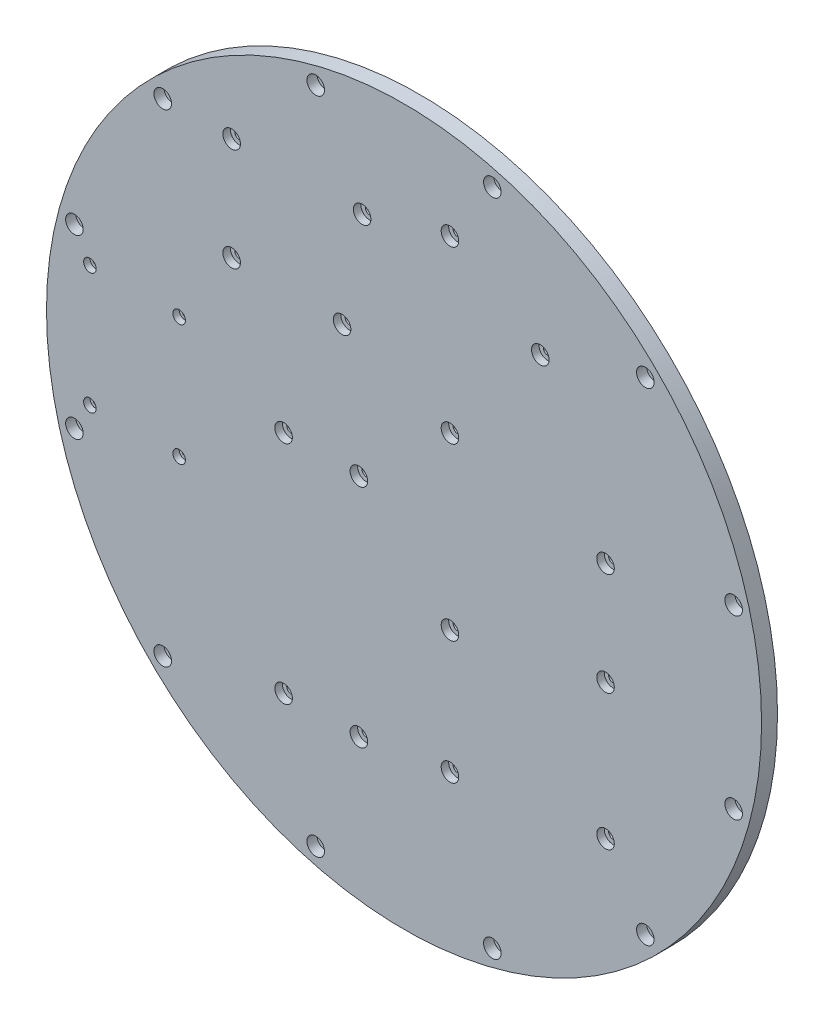
from build123d import *

# Parameters (mm, degrees)
ESQUISSE1_R              = 142.5
ESQUISSE1_R_2            = 1.75
BOSS_EXTRU_1_DEPTH       = 6.35
ESQUISSE2_R              = 3.5
ENL_V_MAT_EXTRU_1_DEPTH  = 4
ENL_V_MAT_EXTRU_2_REACH  = 203.625
ESQUISSE3_R              = 1.25
ESQUISSE4_R              = 2.5
ENL_V_MAT_EXTRU_3_DEPTH  = 2.5
ENL_V_MAT_EXTRU_4_REACH  = 203.625
ESQUISSE5_R              = 1.75
ESQUISSE6_R              = 3.5
ENL_V_MAT_EXTRU_5_DEPTH  = 3
ENL_V_MAT_EXTRU_6_REACH  = 203.625
ESQUISSE7_R              = 1.75
ESQUISSE8_R              = 3.5
ENL_V_MAT_EXTRU_7_DEPTH  = 3
ENL_V_MAT_EXTRU_8_REACH  = 203.625
ESQUISSE9_R              = 1.75
ESQUISSE10_R             = 3.5
ENL_V_MAT_EXTRU_9_DEPTH  = 3
ENL_V_MAT_EXTRU_10_REACH = 203.625
ESQUISSE11_R             = 1.75
ESQUISSE12_R             = 3.5
ENL_V_MAT_EXTRU_11_DEPTH = 3


with BuildPart() as part:
    # Esquisse1 → Boss.-Extru.1 (new body)
    with BuildSketch(Plane.XY):
        Circle(ESQUISSE1_R)
        with Locations((-35.199390134, 131.365912375)):
            Circle(ESQUISSE1_R_2, mode=Mode.SUBTRACT)
        with Locations((35.199390134, 131.365912375)):
            Circle(ESQUISSE1_R_2, mode=Mode.SUBTRACT)
        with Locations((96.166522241, 96.166522241)):
            Circle(ESQUISSE1_R_2, mode=Mode.SUBTRACT)
        with Locations((131.365912375, 35.199390134)):
            Circle(ESQUISSE1_R_2, mode=Mode.SUBTRACT)
        with Locations((131.365912375, -35.199390134)):
            Circle(ESQUISSE1_R_2, mode=Mode.SUBTRACT)
        with Locations((96.166522241, -96.166522241)):
            Circle(ESQUISSE1_R_2, mode=Mode.SUBTRACT)
        with Locations((35.199390134, -131.365912375)):
            Circle(ESQUISSE1_R_2, mode=Mode.SUBTRACT)
        with Locations((-35.199390134, -131.365912375)):
            Circle(ESQUISSE1_R_2, mode=Mode.SUBTRACT)
        with Locations((-96.166522241, -96.166522241)):
            Circle(ESQUISSE1_R_2, mode=Mode.SUBTRACT)
        with Locations((-131.365912375, -35.199390134)):
            Circle(ESQUISSE1_R_2, mode=Mode.SUBTRACT)
        with Locations((-131.365912375, 35.199390134)):
            Circle(ESQUISSE1_R_2, mode=Mode.SUBTRACT)
        with Locations((-96.166522241, 96.166522241)):
            Circle(ESQUISSE1_R_2, mode=Mode.SUBTRACT)
    extrude(amount=BOSS_EXTRU_1_DEPTH)

    # Esquisse2 → Enlèv. mat.-Extru.1 (cut)
    with BuildSketch(Plane.XY.offset(6.35)):
        with Locations((35.199390134, 131.365912375)):
            Circle(ESQUISSE2_R)
        with Locations((96.166522241, 96.166522241)):
            Circle(ESQUISSE2_R)
        with Locations((131.365912375, 35.199390134)):
            Circle(ESQUISSE2_R)
        with Locations((131.365912375, -35.199390134)):
            Circle(ESQUISSE2_R)
        with Locations((96.166522241, -96.166522241)):
            Circle(ESQUISSE2_R)
        with Locations((35.199390134, -131.365912375)):
            Circle(ESQUISSE2_R)
        with Locations((-35.199390134, -131.365912375)):
            Circle(ESQUISSE2_R)
        with Locations((-96.166522241, -96.166522241)):
            Circle(ESQUISSE2_R)
        with Locations((-131.365912375, -35.199390134)):
            Circle(ESQUISSE2_R)
        with Locations((-131.365912375, 35.199390134)):
            Circle(ESQUISSE2_R)
        with Locations((-96.166522241, 96.166522241)):
            Circle(ESQUISSE2_R)
        with Locations((-35.199390134, 131.365912375)):
            Circle(ESQUISSE2_R)
    extrude(amount=-ENL_V_MAT_EXTRU_1_DEPTH, mode=Mode.SUBTRACT)

    # Esquisse3 → Enlèv. mat.-Extru.2 (cut, up to next)
    with BuildSketch(Plane.XY.offset(6.35), mode=Mode.PRIVATE) as enl_v_mat_extru_2_sk1:
        with Locations((-125.19581902, -24.13)):
            Circle(ESQUISSE3_R)
    enl_v_mat_extru_2_tool1 = extrude(enl_v_mat_extru_2_sk1.sketch, amount=-ENL_V_MAT_EXTRU_2_REACH, mode=Mode.PRIVATE) & part.part
    # Esquisse3 → Enlèv. mat.-Extru.2 (cut, up to next)
    with BuildSketch(Plane.XY.offset(6.35), mode=Mode.PRIVATE) as enl_v_mat_extru_2_sk2:
        with Locations((-125.19581902, 24.13)):
            Circle(ESQUISSE3_R)
    enl_v_mat_extru_2_tool2 = extrude(enl_v_mat_extru_2_sk2.sketch, amount=-ENL_V_MAT_EXTRU_2_REACH, mode=Mode.PRIVATE) & part.part
    # Esquisse3 → Enlèv. mat.-Extru.2 (cut, up to next)
    with BuildSketch(Plane.XY.offset(6.35), mode=Mode.PRIVATE) as enl_v_mat_extru_2_sk3:
        with Locations((-89.63581902, 24.13)):
            Circle(ESQUISSE3_R)
    enl_v_mat_extru_2_tool3 = extrude(enl_v_mat_extru_2_sk3.sketch, amount=-ENL_V_MAT_EXTRU_2_REACH, mode=Mode.PRIVATE) & part.part
    # Esquisse3 → Enlèv. mat.-Extru.2 (cut, up to next)
    with BuildSketch(Plane.XY.offset(6.35), mode=Mode.PRIVATE) as enl_v_mat_extru_2_sk4:
        with Locations((-89.63581902, -24.13)):
            Circle(ESQUISSE3_R)
    enl_v_mat_extru_2_tool4 = extrude(enl_v_mat_extru_2_sk4.sketch, amount=-ENL_V_MAT_EXTRU_2_REACH, mode=Mode.PRIVATE) & part.part
    add(enl_v_mat_extru_2_tool1.solids().sort_by_distance((-125.195819, -24.13, 6.35))[0], mode=Mode.SUBTRACT)
    add(enl_v_mat_extru_2_tool2.solids().sort_by_distance((-125.195819, 24.13, 6.35))[0], mode=Mode.SUBTRACT)
    add(enl_v_mat_extru_2_tool3.solids().sort_by_distance((-89.635819, 24.13, 6.35))[0], mode=Mode.SUBTRACT)
    add(enl_v_mat_extru_2_tool4.solids().sort_by_distance((-89.635819, -24.13, 6.35))[0], mode=Mode.SUBTRACT)

    # Esquisse4 → Enlèv. mat.-Extru.3 (cut)
    with BuildSketch(Plane.XY.offset(6.35)):
        with Locations((-125.19581902, -24.13)):
            Circle(ESQUISSE4_R)
        with Locations((-125.19581902, 24.13)):
            Circle(ESQUISSE4_R)
        with Locations((-89.63581902, 24.13)):
            Circle(ESQUISSE4_R)
        with Locations((-89.63581902, -24.13)):
            Circle(ESQUISSE4_R)
    extrude(amount=-ENL_V_MAT_EXTRU_3_DEPTH, mode=Mode.SUBTRACT)

    # Esquisse5 → Enlèv. mat.-Extru.4 (cut, up to next)
    with BuildSketch(Plane.XY.offset(6.35), mode=Mode.PRIVATE) as enl_v_mat_extru_4_sk1:
        with Locations((-48, -85)):
            Circle(ESQUISSE5_R)
    enl_v_mat_extru_4_tool1 = extrude(enl_v_mat_extru_4_sk1.sketch, amount=-ENL_V_MAT_EXTRU_4_REACH, mode=Mode.PRIVATE) & part.part
    # Esquisse5 → Enlèv. mat.-Extru.4 (cut, up to next)
    with BuildSketch(Plane.XY.offset(6.35), mode=Mode.PRIVATE) as enl_v_mat_extru_4_sk2:
        with Locations((-48, 5)):
            Circle(ESQUISSE5_R)
    enl_v_mat_extru_4_tool2 = extrude(enl_v_mat_extru_4_sk2.sketch, amount=-ENL_V_MAT_EXTRU_4_REACH, mode=Mode.PRIVATE) & part.part
    # Esquisse5 → Enlèv. mat.-Extru.4 (cut, up to next)
    with BuildSketch(Plane.XY.offset(6.35), mode=Mode.PRIVATE) as enl_v_mat_extru_4_sk3:
        with Locations((-18, 5)):
            Circle(ESQUISSE5_R)
    enl_v_mat_extru_4_tool3 = extrude(enl_v_mat_extru_4_sk3.sketch, amount=-ENL_V_MAT_EXTRU_4_REACH, mode=Mode.PRIVATE) & part.part
    # Esquisse5 → Enlèv. mat.-Extru.4 (cut, up to next)
    with BuildSketch(Plane.XY.offset(6.35), mode=Mode.PRIVATE) as enl_v_mat_extru_4_sk4:
        with Locations((-18, -85)):
            Circle(ESQUISSE5_R)
    enl_v_mat_extru_4_tool4 = extrude(enl_v_mat_extru_4_sk4.sketch, amount=-ENL_V_MAT_EXTRU_4_REACH, mode=Mode.PRIVATE) & part.part
    add(enl_v_mat_extru_4_tool1.solids().sort_by_distance((-48, -85, 6.35))[0], mode=Mode.SUBTRACT)
    add(enl_v_mat_extru_4_tool2.solids().sort_by_distance((-48, 5, 6.35))[0], mode=Mode.SUBTRACT)
    add(enl_v_mat_extru_4_tool3.solids().sort_by_distance((-18, 5, 6.35))[0], mode=Mode.SUBTRACT)
    add(enl_v_mat_extru_4_tool4.solids().sort_by_distance((-18, -85, 6.35))[0], mode=Mode.SUBTRACT)

    # Esquisse6 → Enlèv. mat.-Extru.5 (cut)
    with BuildSketch(Plane.XY.offset(6.35)):
        with Locations((-48, -85)):
            Circle(ESQUISSE6_R)
        with Locations((-18, -85)):
            Circle(ESQUISSE6_R)
        with Locations((-48, 5)):
            Circle(ESQUISSE6_R)
        with Locations((-18, 5)):
            Circle(ESQUISSE6_R)
    extrude(amount=-ENL_V_MAT_EXTRU_5_DEPTH, mode=Mode.SUBTRACT)

    # Esquisse7 → Enlèv. mat.-Extru.6 (cut, up to next)
    with BuildSketch(Plane.XY.offset(6.35), mode=Mode.PRIVATE) as enl_v_mat_extru_6_sk1:
        with Locations((-68.7, 55)):
            Circle(ESQUISSE7_R)
    enl_v_mat_extru_6_tool1 = extrude(enl_v_mat_extru_6_sk1.sketch, amount=-ENL_V_MAT_EXTRU_6_REACH, mode=Mode.PRIVATE) & part.part
    # Esquisse7 → Enlèv. mat.-Extru.6 (cut, up to next)
    with BuildSketch(Plane.XY.offset(6.35), mode=Mode.PRIVATE) as enl_v_mat_extru_6_sk2:
        with Locations((-68.7, 96)):
            Circle(ESQUISSE7_R)
    enl_v_mat_extru_6_tool2 = extrude(enl_v_mat_extru_6_sk2.sketch, amount=-ENL_V_MAT_EXTRU_6_REACH, mode=Mode.PRIVATE) & part.part
    # Esquisse7 → Enlèv. mat.-Extru.6 (cut, up to next)
    with BuildSketch(Plane.XY.offset(6.35), mode=Mode.PRIVATE) as enl_v_mat_extru_6_sk3:
        with Locations((-24.7, 54)):
            Circle(ESQUISSE7_R)
    enl_v_mat_extru_6_tool3 = extrude(enl_v_mat_extru_6_sk3.sketch, amount=-ENL_V_MAT_EXTRU_6_REACH, mode=Mode.PRIVATE) & part.part
    # Esquisse7 → Enlèv. mat.-Extru.6 (cut, up to next)
    with BuildSketch(Plane.XY.offset(6.35), mode=Mode.PRIVATE) as enl_v_mat_extru_6_sk4:
        with Locations((-16.7, 96)):
            Circle(ESQUISSE7_R)
    enl_v_mat_extru_6_tool4 = extrude(enl_v_mat_extru_6_sk4.sketch, amount=-ENL_V_MAT_EXTRU_6_REACH, mode=Mode.PRIVATE) & part.part
    add(enl_v_mat_extru_6_tool1.solids().sort_by_distance((-68.7, 55, 6.35))[0], mode=Mode.SUBTRACT)
    add(enl_v_mat_extru_6_tool2.solids().sort_by_distance((-68.7, 96, 6.35))[0], mode=Mode.SUBTRACT)
    add(enl_v_mat_extru_6_tool3.solids().sort_by_distance((-24.7, 54, 6.35))[0], mode=Mode.SUBTRACT)
    add(enl_v_mat_extru_6_tool4.solids().sort_by_distance((-16.7, 96, 6.35))[0], mode=Mode.SUBTRACT)

    # Esquisse8 → Enlèv. mat.-Extru.7 (cut)
    with BuildSketch(Plane.XY.offset(6.35)):
        with Locations((-68.7, 55)):
            Circle(ESQUISSE8_R)
        with Locations((-68.7, 96)):
            Circle(ESQUISSE8_R)
        with Locations((-24.7, 54)):
            Circle(ESQUISSE8_R)
        with Locations((-16.7, 96)):
            Circle(ESQUISSE8_R)
    extrude(amount=-ENL_V_MAT_EXTRU_7_DEPTH, mode=Mode.SUBTRACT)

    # Esquisse9 → Enlèv. mat.-Extru.8 (cut, up to next)
    with BuildSketch(Plane(origin=(0, 0, 6.35), x_dir=(-1, 0, 0), z_dir=(0, 0, -1)), mode=Mode.PRIVATE) as enl_v_mat_extru_8_sk1:
        with Locations((-18.3, 106)):
            Circle(ESQUISSE9_R)
    enl_v_mat_extru_8_tool1 = extrude(enl_v_mat_extru_8_sk1.sketch, amount=ENL_V_MAT_EXTRU_8_REACH, mode=Mode.PRIVATE) & part.part
    # Esquisse9 → Enlèv. mat.-Extru.8 (cut, up to next)
    with BuildSketch(Plane(origin=(0, 0, 6.35), x_dir=(-1, 0, 0), z_dir=(0, 0, -1)), mode=Mode.PRIVATE) as enl_v_mat_extru_8_sk2:
        with Locations((-18.3, 38)):
            Circle(ESQUISSE9_R)
    enl_v_mat_extru_8_tool2 = extrude(enl_v_mat_extru_8_sk2.sketch, amount=ENL_V_MAT_EXTRU_8_REACH, mode=Mode.PRIVATE) & part.part
    # Esquisse9 → Enlèv. mat.-Extru.8 (cut, up to next)
    with BuildSketch(Plane(origin=(0, 0, 6.35), x_dir=(-1, 0, 0), z_dir=(0, 0, -1)), mode=Mode.PRIVATE) as enl_v_mat_extru_8_sk3:
        with Locations((-54.3, 83)):
            Circle(ESQUISSE9_R)
    enl_v_mat_extru_8_tool3 = extrude(enl_v_mat_extru_8_sk3.sketch, amount=ENL_V_MAT_EXTRU_8_REACH, mode=Mode.PRIVATE) & part.part
    # Esquisse9 → Enlèv. mat.-Extru.8 (cut, up to next)
    with BuildSketch(Plane(origin=(0, 0, 6.35), x_dir=(-1, 0, 0), z_dir=(0, 0, -1)), mode=Mode.PRIVATE) as enl_v_mat_extru_8_sk4:
        with Locations((-80.3, 24)):
            Circle(ESQUISSE9_R)
    enl_v_mat_extru_8_tool4 = extrude(enl_v_mat_extru_8_sk4.sketch, amount=ENL_V_MAT_EXTRU_8_REACH, mode=Mode.PRIVATE) & part.part
    add(enl_v_mat_extru_8_tool1.solids().sort_by_distance((18.3, 106, 6.35))[0], mode=Mode.SUBTRACT)
    add(enl_v_mat_extru_8_tool2.solids().sort_by_distance((18.3, 38, 6.35))[0], mode=Mode.SUBTRACT)
    add(enl_v_mat_extru_8_tool3.solids().sort_by_distance((54.3, 83, 6.35))[0], mode=Mode.SUBTRACT)
    add(enl_v_mat_extru_8_tool4.solids().sort_by_distance((80.3, 24, 6.35))[0], mode=Mode.SUBTRACT)

    # Esquisse10 → Enlèv. mat.-Extru.9 (cut)
    with BuildSketch(Plane.XY.offset(6.35)):
        with Locations((18.3, 38)):
            Circle(ESQUISSE10_R)
        with Locations((18.3, 106)):
            Circle(ESQUISSE10_R)
        with Locations((54.3, 83)):
            Circle(ESQUISSE10_R)
        with Locations((80.3, 24)):
            Circle(ESQUISSE10_R)
    extrude(amount=-ENL_V_MAT_EXTRU_9_DEPTH, mode=Mode.SUBTRACT)

    # Esquisse11 → Enlèv. mat.-Extru.10 (cut, up to next)
    with BuildSketch(Plane(origin=(0, 0, 6.35), x_dir=(-1, 0, 0), z_dir=(0, 0, -1)), mode=Mode.PRIVATE) as enl_v_mat_extru_10_sk1:
        with Locations((-18.3, -30)):
            Circle(ESQUISSE11_R)
    enl_v_mat_extru_10_tool1 = extrude(enl_v_mat_extru_10_sk1.sketch, amount=ENL_V_MAT_EXTRU_10_REACH, mode=Mode.PRIVATE) & part.part
    # Esquisse11 → Enlèv. mat.-Extru.10 (cut, up to next)
    with BuildSketch(Plane(origin=(0, 0, 6.35), x_dir=(-1, 0, 0), z_dir=(0, 0, -1)), mode=Mode.PRIVATE) as enl_v_mat_extru_10_sk2:
        with Locations((-18.3, -79)):
            Circle(ESQUISSE11_R)
    enl_v_mat_extru_10_tool2 = extrude(enl_v_mat_extru_10_sk2.sketch, amount=ENL_V_MAT_EXTRU_10_REACH, mode=Mode.PRIVATE) & part.part
    # Esquisse11 → Enlèv. mat.-Extru.10 (cut, up to next)
    with BuildSketch(Plane(origin=(0, 0, 6.35), x_dir=(-1, 0, 0), z_dir=(0, 0, -1)), mode=Mode.PRIVATE) as enl_v_mat_extru_10_sk3:
        with Locations((-80.3, -17)):
            Circle(ESQUISSE11_R)
    enl_v_mat_extru_10_tool3 = extrude(enl_v_mat_extru_10_sk3.sketch, amount=ENL_V_MAT_EXTRU_10_REACH, mode=Mode.PRIVATE) & part.part
    # Esquisse11 → Enlèv. mat.-Extru.10 (cut, up to next)
    with BuildSketch(Plane(origin=(0, 0, 6.35), x_dir=(-1, 0, 0), z_dir=(0, 0, -1)), mode=Mode.PRIVATE) as enl_v_mat_extru_10_sk4:
        with Locations((-80.3, -71)):
            Circle(ESQUISSE11_R)
    enl_v_mat_extru_10_tool4 = extrude(enl_v_mat_extru_10_sk4.sketch, amount=ENL_V_MAT_EXTRU_10_REACH, mode=Mode.PRIVATE) & part.part
    add(enl_v_mat_extru_10_tool1.solids().sort_by_distance((18.3, -30, 6.35))[0], mode=Mode.SUBTRACT)
    add(enl_v_mat_extru_10_tool2.solids().sort_by_distance((18.3, -79, 6.35))[0], mode=Mode.SUBTRACT)
    add(enl_v_mat_extru_10_tool3.solids().sort_by_distance((80.3, -17, 6.35))[0], mode=Mode.SUBTRACT)
    add(enl_v_mat_extru_10_tool4.solids().sort_by_distance((80.3, -71, 6.35))[0], mode=Mode.SUBTRACT)

    # Esquisse12 → Enlèv. mat.-Extru.11 (cut)
    with BuildSketch(Plane.XY.offset(6.35)):
        with Locations((18.3, -79)):
            Circle(ESQUISSE12_R)
        with Locations((18.3, -30)):
            Circle(ESQUISSE12_R)
        with Locations((80.3, -17)):
            Circle(ESQUISSE12_R)
        with Locations((80.3, -71)):
            Circle(ESQUISSE12_R)
    extrude(amount=-ENL_V_MAT_EXTRU_11_DEPTH, mode=Mode.SUBTRACT)


solid = part.part
